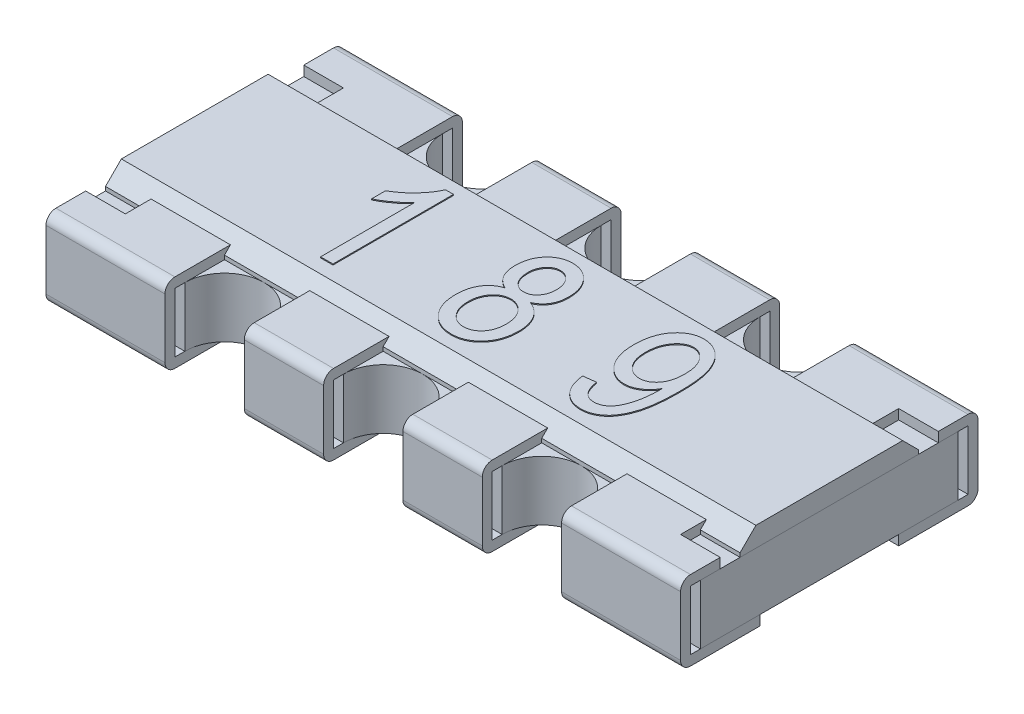
from build123d import *

# Parameters (mm, degrees)
EXTRUDE_THIN1_DEPTH = 1.6
SKETCH6_W           = 0.4
SKETCH6_H           = 0.5
CUT_EXTRUDE3_DEPTH  = 2.811767093
SKETCH7_W           = 0.2
SKETCH7_H           = 1.1
CUT_EXTRUDE4_DEPTH  = 0.1
SKETCH1_W           = 3.2
SKETCH1_H           = 1.3
BOSS_EXTRUDE3_DEPTH = 0.3
SKETCH9_W           = 3.2
SKETCH9_H           = 0.9
BOSS_EXTRUDE4_DEPTH = 0.1
CHAMFER1_START      = -3
CHAMFER1_DEPTH      = 6
CHAMFER1_START_2    = -1
CHAMFER1_2_DEPTH    = 0.4
CHAMFER1_START_3    = -0.2
CHAMFER1_3_DEPTH    = 0.4
CHAMFER1_START_4    = 0.6
CHAMFER1_4_DEPTH    = 0.4
CHAMFER1_5_DEPTH    = 1.6
CHAMFER1_START_5    = 1.4
CHAMFER1_6_DEPTH    = 1.6
SKETCH10_R          = 0.2
CUT_EXTRUDE7_DEPTH  = 5
BOSS_EXTRUDE5_DEPTH = 0.005


with BuildPart() as part:
    # Sketch5 → Extrude-Thin1 (new, symmetric)
    with BuildSketch(Plane(origin=(0, 0, 0), x_dir=(0, 0, -1), z_dir=(1, 0, 0))):
        with BuildLine():
            Line((-0.35, 0), (-0.7, 0))
            ThreePointArc((-0.7, 0), (-0.735355339, 0.014644661), (-0.75, 0.05))
            Line((-0.75, 0.05), (-0.75, 0.35))
            ThreePointArc((-0.75, 0.35), (-0.735355339, 0.385355339), (-0.7, 0.4))
            Line((-0.7, 0.4), (0.7, 0.4))
            ThreePointArc((0.7, 0.4), (0.735355339, 0.385355339), (0.75, 0.35))
            Line((0.75, 0.35), (0.75, 0.05))
            ThreePointArc((0.75, 0.05), (0.735355339, 0.014644661), (0.7, 0))
            Line((0.7, 0), (0.35, 0))
            Line((0.35, 0), (0.35, 0.05))
            Line((0.35, 0.05), (0.7, 0.05))
            Line((0.7, 0.05), (0.7, 0.35))
            Line((0.7, 0.35), (-0.7, 0.35))
            Line((-0.7, 0.35), (-0.7, 0.05))
            Line((-0.7, 0.05), (-0.35, 0.05))
            Line((-0.35, 0.05), (-0.35, 0))
        make_face()
    extrude(amount=EXTRUDE_THIN1_DEPTH, both=True)

    # Sketch6 → Cut-Extrude3 (cut, through all)
    with BuildSketch(Plane(origin=(0, 0.4, 0), x_dir=(1, 0, 0), z_dir=(0, 1, 0))):
        with Locations((-0.8, 0.5)):
            Rectangle(SKETCH6_W, SKETCH6_H)
        with Locations((0, 0.5)):
            Rectangle(SKETCH6_W, SKETCH6_H)
        with Locations((0.8, 0.5)):
            Rectangle(SKETCH6_W, SKETCH6_H)
        with Locations((-0.8, -0.5)):
            Rectangle(SKETCH6_W, SKETCH6_H)
        with Locations((0, -0.5)):
            Rectangle(SKETCH6_W, SKETCH6_H)
        with Locations((0.8, -0.5)):
            Rectangle(SKETCH6_W, SKETCH6_H)
    extrude(amount=-CUT_EXTRUDE3_DEPTH, mode=Mode.SUBTRACT)

    # Sketch7 → Cut-Extrude4 (cut)
    with BuildSketch(Plane(origin=(0, 0.4, 0), x_dir=(1, 0, 0), z_dir=(0, 1, 0))):
        with Locations((-1.5, 0)):
            Rectangle(SKETCH7_W, SKETCH7_H)
        with Locations((1.5, 0)):
            Rectangle(SKETCH7_W, SKETCH7_H)
    extrude(amount=-CUT_EXTRUDE4_DEPTH, mode=Mode.SUBTRACT)

    # Sketch9 → Boss-Extrude4 (add)
    with BuildSketch(Plane(origin=(0, 0.35, 0), x_dir=(1, 0, 0), z_dir=(0, 1, 0))):
        Rectangle(SKETCH9_W, SKETCH9_H)
    extrude(amount=BOSS_EXTRUDE4_DEPTH)

    # Chamfer1: read off the stored shape, not the designer's step
    # Chamfer1 outline → Chamfer1 (cut)
    with BuildSketch(Plane.YZ.offset(CHAMFER1_START)):
        Polygon((0.45, 0.45), (0.4, 0.45), (0.4, 0.42), (0.45, 0.37), align=None)
        Polygon((0.45, -0.45), (0.45, -0.37), (0.4, -0.42), (0.4, -0.45), align=None)
    extrude(amount=CHAMFER1_DEPTH, mode=Mode.SUBTRACT)

    # Chamfer1 2 outline → Chamfer1 2 (cut)
    with BuildSketch(Plane.YZ.offset(CHAMFER1_START_2)):
        Polygon((0.4, 0.42), (0.4, 0.45), (0.37, 0.45), align=None)
        Polygon((0.4, -0.45), (0.4, -0.42), (0.37, -0.45), align=None)
    extrude(amount=CHAMFER1_2_DEPTH, mode=Mode.SUBTRACT)

    # Chamfer1 3 outline → Chamfer1 3 (cut)
    with BuildSketch(Plane.YZ.offset(CHAMFER1_START_3)):
        Polygon((0.4, 0.42), (0.4, 0.45), (0.37, 0.45), align=None)
        Polygon((0.4, -0.45), (0.4, -0.42), (0.37, -0.45), align=None)
    extrude(amount=CHAMFER1_3_DEPTH, mode=Mode.SUBTRACT)

    # Chamfer1 4 outline → Chamfer1 4 (cut)
    with BuildSketch(Plane.YZ.offset(CHAMFER1_START_4)):
        Polygon((0.4, 0.42), (0.4, 0.45), (0.37, 0.45), align=None)
        Polygon((0.4, -0.45), (0.4, -0.42), (0.37, -0.45), align=None)
    extrude(amount=CHAMFER1_4_DEPTH, mode=Mode.SUBTRACT)

    # Chamfer1 5 outline → Chamfer1 5 (cut)
    with BuildSketch(Plane.YZ.offset(CHAMFER1_START)):
        Polygon((0.4, 0.42), (0.4, 0.45), (0.37, 0.45), align=None)
        Polygon((0.4, -0.45), (0.4, -0.42), (0.37, -0.45), align=None)
    extrude(amount=CHAMFER1_5_DEPTH, mode=Mode.SUBTRACT)

    # Chamfer1 6 outline → Chamfer1 6 (cut)
    with BuildSketch(Plane.YZ.offset(CHAMFER1_START_5)):
        Polygon((0.4, 0.42), (0.4, 0.45), (0.37, 0.45), align=None)
        Polygon((0.4, -0.45), (0.4, -0.42), (0.37, -0.45), align=None)
    extrude(amount=CHAMFER1_6_DEPTH, mode=Mode.SUBTRACT)

    # Sketch11 → Boss-Extrude5 (add)
    # profile 1 of 3: a face of its own
    with BuildSketch(Plane(origin=(0, 0.45, 0), x_dir=(1, 0, 0), z_dir=(0, 1, 0))):
        with BuildLine():
            Line((-0.602857143, -0.3), (-0.665194805, -0.3))
            Line((-0.665194805, -0.3), (-0.665194805, 0.175324675))
            add(Edge.make_bspline(
                [(-0.665194805, 0.175324675), (-0.669023189, 0.170917878), (-0.676957509, 0.161784794), (-0.690731083, 0.148796276), (-0.70608021, 0.135402465), (-0.72307373, 0.122405736), (-0.740388775, 0.109956973), (-0.7574906, 0.099008069), (-0.773738236, 0.089481697), (-0.784638106, 0.084303674), (-0.78987013, 0.081818182)],
                knots=[0, 0, 0, 0, 0.892555828, 1.849821039, 2.893015883, 4.008277588, 5.121255548, 6.154629642, 7.114207698, 8, 8, 8, 8], degree=3))
            Line((-0.78987013, 0.081818182), (-0.78987013, 0.151948052))
            add(Edge.make_bspline(
                [(-0.78987013, 0.151948052), (-0.781461846, 0.157008477), (-0.764717276, 0.167085997), (-0.741255942, 0.184543515), (-0.719092323, 0.203386035), (-0.698888884, 0.223810986), (-0.680798923, 0.244866052), (-0.665271894, 0.265879035), (-0.652540714, 0.286626673), (-0.646295662, 0.300898654), (-0.643279221, 0.307792208)],
                knots=[0, 0, 0, 0, 1.082272232, 2.155277244, 3.222407096, 4.289527553, 5.32168536, 6.282742408, 7.170542132, 8, 8, 8, 8], degree=3))
            Line((-0.643279221, 0.307792208), (-0.602857143, 0.307792208))
            Line((-0.602857143, 0.307792208), (-0.602857143, -0.3))
        make_face()
    # profile 2 of 3: a face of its own
    with BuildSketch(Plane(origin=(0, 0.45, 0), x_dir=(1, 0, 0), z_dir=(0, 1, 0))):
        with BuildLine():
            add(Edge.make_bspline(
                [(-0.063952922, 0.029220779), (-0.069688575, 0.032103119), (-0.080878932, 0.037726614), (-0.095794406, 0.048741408), (-0.10851293, 0.061533167), (-0.118989664, 0.076194031), (-0.127095518, 0.092738293), (-0.132731255, 0.111107866), (-0.136395751, 0.131267135), (-0.136716444, 0.145356148), (-0.136883117, 0.152678571)],
                knots=[0, 0, 0, 0, 1.008302473, 1.967215395, 2.901654035, 3.835241807, 4.788827276, 5.786238528, 6.849451133, 8, 8, 8, 8], degree=3))
            add(Edge.make_bspline(
                [(-0.136883117, 0.152678571), (-0.136771499, 0.158284181), (-0.136553302, 0.169242314), (-0.134691032, 0.185291441), (-0.131632439, 0.200505694), (-0.127583097, 0.214996903), (-0.121981094, 0.228544599), (-0.115449116, 0.241469087), (-0.107476728, 0.253482827), (-0.098514623, 0.26469507), (-0.08856843, 0.27474034), (-0.077937656, 0.283570238), (-0.066656484, 0.291090595), (-0.054700741, 0.297153342), (-0.042180382, 0.301952543), (-0.02904559, 0.305410577), (-0.015266907, 0.307315186), (-0.005882071, 0.307631819), (-0.001128247, 0.307792208)],
                knots=[0, 0, 0, 0, 1.165528948, 2.278436123, 3.35437051, 4.390847764, 5.401785756, 6.398351761, 7.397951243, 8.394481506, 9.379254266, 10.332413116, 11.264104055, 12.192693114, 13.114390379, 14.047914605, 15.011184464, 16, 16, 16, 16], degree=3))
            add(Edge.make_bspline(
                [(-0.001128247, 0.307792208), (0.003668022, 0.307645546), (0.013143166, 0.307355811), (0.027020947, 0.30525174), (0.040283534, 0.301830966), (0.052931066, 0.297076614), (0.064943351, 0.290815339), (0.076243059, 0.283106641), (0.086970165, 0.274093232), (0.096981587, 0.263833866), (0.106068365, 0.252446334), (0.113989019, 0.240177379), (0.120917036, 0.22724906), (0.126363099, 0.213375566), (0.130639961, 0.19870367), (0.133637907, 0.183215575), (0.135512931, 0.166969851), (0.135732342, 0.155889953), (0.135844156, 0.150243506)],
                knots=[0, 0, 0, 0, 0.985268531, 1.946421878, 2.87680472, 3.795226773, 4.71648376, 5.65319809, 6.600248485, 7.590936614, 8.593729089, 9.588305238, 10.588007114, 11.602279753, 12.644649782, 13.724021809, 14.840134863, 16, 16, 16, 16], degree=3))
            add(Edge.make_bspline(
                [(0.135844156, 0.150243506), (0.13566623, 0.143205892), (0.135323496, 0.129649528), (0.131788568, 0.110180811), (0.12628551, 0.092331927), (0.118273174, 0.076203524), (0.108031196, 0.061711696), (0.095453277, 0.048998315), (0.080665707, 0.037779681), (0.069430808, 0.032130358), (0.063644481, 0.029220779)],
                knots=[0, 0, 0, 0, 1.126288406, 2.16953834, 3.158564267, 4.109347243, 5.041996175, 5.989081932, 6.964313779, 8, 8, 8, 8], degree=3))
            add(Edge.make_bspline(
                [(0.063644481, 0.029220779), (0.067406002, 0.027699127), (0.074854663, 0.024685914), (0.08540299, 0.019157918), (0.095354188, 0.013100665), (0.104488717, 0.006204903), (0.113079727, -0.001234443), (0.121014328, -0.009395238), (0.128196046, -0.01830272), (0.134636418, -0.027872557), (0.140580111, -0.037964075), (0.145468322, -0.048831691), (0.149814806, -0.060184259), (0.153171151, -0.07218197), (0.155861258, -0.084747042), (0.157764937, -0.097885307), (0.159061053, -0.111621818), (0.159166683, -0.120978993), (0.159220779, -0.125771104)],
                knots=[0, 0, 0, 0, 0.998518868, 1.977292132, 2.928488769, 3.863806314, 4.791620617, 5.724425947, 6.662355446, 7.604692757, 8.562792825, 9.541974082, 10.534927333, 11.553397264, 12.605860047, 13.696849039, 14.820482036, 16, 16, 16, 16], degree=3))
            add(Edge.make_bspline(
                [(0.159220779, -0.125771104), (0.159070241, -0.13230953), (0.158774936, -0.145135727), (0.156760938, -0.163937218), (0.153026375, -0.181790019), (0.148113973, -0.198784915), (0.141597224, -0.214779607), (0.133796313, -0.229930942), (0.124367202, -0.244034464), (0.113679552, -0.257155165), (0.101996355, -0.269006087), (0.089444985, -0.279334214), (0.076261771, -0.288161079), (0.062325399, -0.295434977), (0.047598952, -0.30084361), (0.032299468, -0.304969718), (0.016269356, -0.3072475), (0.005371831, -0.30760893), (-0.000154221, -0.307792208)],
                knots=[0, 0, 0, 0, 1.159749967, 2.275040396, 3.347967098, 4.391166783, 5.408413163, 6.406504519, 7.408740576, 8.411571025, 9.404143995, 10.355316395, 11.289670068, 12.213679047, 13.136228826, 14.066859406, 15.019719104, 16, 16, 16, 16], degree=3))
            add(Edge.make_bspline(
                [(-0.000154221, -0.307792208), (-0.005761662, -0.307610962), (-0.016781062, -0.30725479), (-0.032969765, -0.304964743), (-0.048362884, -0.30087134), (-0.063142938, -0.29539934), (-0.077162937, -0.288204944), (-0.090366817, -0.279289154), (-0.103035924, -0.26905444), (-0.114697959, -0.257138914), (-0.125473004, -0.244064122), (-0.134660571, -0.229726812), (-0.142707592, -0.21454818), (-0.149121783, -0.198282145), (-0.154135899, -0.181039442), (-0.157600506, -0.162772278), (-0.159867184, -0.143563379), (-0.16012726, -0.130404366), (-0.16025974, -0.123701299)],
                knots=[0, 0, 0, 0, 0.984972937, 1.935608695, 2.864070717, 3.777636659, 4.698984135, 5.624239024, 6.571662262, 7.554569506, 8.54763434, 9.542156389, 10.540146702, 11.560717074, 12.60743999, 13.689489912, 14.823049757, 16, 16, 16, 16], degree=3))
            add(Edge.make_bspline(
                [(-0.16025974, -0.123701299), (-0.160200864, -0.118788068), (-0.160085354, -0.109148616), (-0.158845784, -0.094993626), (-0.156779608, -0.081497747), (-0.153990428, -0.068682501), (-0.150471866, -0.056535504), (-0.146079454, -0.045048387), (-0.14085167, -0.034221483), (-0.134840391, -0.024056784), (-0.128190404, -0.014588089), (-0.120867179, -0.005897753), (-0.112890302, 0.001935433), (-0.104332727, 0.009014026), (-0.095180862, 0.015422322), (-0.085309454, 0.020838386), (-0.074886932, 0.02553675), (-0.067628532, 0.027982345), (-0.063952922, 0.029220779)],
                knots=[0, 0, 0, 0, 1.21084686, 2.375606163, 3.49898943, 4.574306622, 5.606312177, 6.613285576, 7.602106595, 8.566331322, 9.521116698, 10.451051306, 11.363604456, 12.273026677, 13.186018397, 14.112988761, 15.044428814, 16, 16, 16, 16], degree=3))
        make_face()
        with BuildLine():
            add(Edge.make_bspline(
                [(-0.074545455, 0.154383117), (-0.074311381, 0.147423054), (-0.073863498, 0.134105502), (-0.069843839, 0.115171062), (-0.06299744, 0.098491557), (-0.053625858, 0.084224964), (-0.042161076, 0.072902561), (-0.029374019, 0.064401779), (-0.015133139, 0.059291962), (-0.00518613, 0.058727237), (-0.000154221, 0.058441558)],
                knots=[0, 0, 0, 0, 1.231806288, 2.356967922, 3.407623546, 4.408504678, 5.359070988, 6.242373184, 7.110866593, 8, 8, 8, 8], degree=3))
            add(Edge.make_bspline(
                [(-0.000154221, 0.058441558), (0.004801204, 0.058720966), (0.01459935, 0.059273427), (0.028534567, 0.064477686), (0.041297596, 0.072616523), (0.052502297, 0.08387803), (0.061879589, 0.097646439), (0.068750654, 0.113578576), (0.072811498, 0.131414359), (0.073269044, 0.143890574), (0.073506494, 0.15036526)],
                knots=[0, 0, 0, 0, 0.904069307, 1.787576968, 2.686104763, 3.657927982, 4.673759711, 5.718490521, 6.815982417, 8, 8, 8, 8], degree=3))
            add(Edge.make_bspline(
                [(0.073506494, 0.15036526), (0.073278276, 0.15704401), (0.072837861, 0.169932669), (0.068654798, 0.188291632), (0.061642837, 0.204758444), (0.0518804, 0.218874195), (0.04050598, 0.23060992), (0.027690852, 0.239137622), (0.013763936, 0.244496169), (0.004031846, 0.245132882), (-0.00088474, 0.245454545)],
                knots=[0, 0, 0, 0, 1.195037322, 2.306184118, 3.351541185, 4.382027117, 5.363972266, 6.261309376, 7.121625266, 8, 8, 8, 8], degree=3))
            add(Edge.make_bspline(
                [(-0.00088474, 0.245454545), (-0.005798161, 0.245172151), (-0.015514491, 0.244613715), (-0.029431034, 0.239422368), (-0.042115054, 0.230974576), (-0.053335121, 0.21955531), (-0.062918822, 0.205890221), (-0.069552538, 0.190100247), (-0.073902782, 0.172797775), (-0.074326347, 0.160661259), (-0.074545455, 0.154383117)],
                knots=[0, 0, 0, 0, 0.904281018, 1.788222997, 2.702503877, 3.698439792, 4.727116192, 5.763971808, 6.843317031, 8, 8, 8, 8], degree=3))
        make_face(mode=Mode.SUBTRACT)
        with BuildLine():
            add(Edge.make_bspline(
                [(-0.097922078, -0.123457792), (-0.097824358, -0.127925779), (-0.097632911, -0.136679169), (-0.096260905, -0.149454476), (-0.094142926, -0.161573595), (-0.090913333, -0.172958389), (-0.086928001, -0.183750888), (-0.081927335, -0.193858606), (-0.076019236, -0.203289725), (-0.069418722, -0.212054066), (-0.061960526, -0.21973158), (-0.054269746, -0.226679087), (-0.046164491, -0.232515815), (-0.037606244, -0.237224414), (-0.02872508, -0.240843324), (-0.019523767, -0.243580262), (-0.009952706, -0.245208113), (-0.003447765, -0.245371713), (-0.000154221, -0.245454545)],
                knots=[0, 0, 0, 0, 1.229957658, 2.409653497, 3.534020377, 4.613053928, 5.663236106, 6.697665706, 7.711552779, 8.723960985, 9.711901018, 10.6537745, 11.574735704, 12.45493582, 13.336836533, 14.210201145, 15.093799183, 16, 16, 16, 16], degree=3))
            add(Edge.make_bspline(
                [(-0.000154221, -0.245454545), (0.003181284, -0.245378126), (0.009729531, -0.245228099), (0.019350691, -0.243525267), (0.028592942, -0.241027843), (0.037440891, -0.237434347), (0.045922656, -0.23291367), (0.053954214, -0.227290004), (0.061568515, -0.220586107), (0.068835194, -0.213039102), (0.075319269, -0.204471378), (0.08131227, -0.195395081), (0.085932966, -0.185386095), (0.09008844, -0.174909583), (0.093004427, -0.163601981), (0.095443676, -0.151675479), (0.096534934, -0.138980834), (0.096765403, -0.130317634), (0.096883117, -0.125892857)],
                knots=[0, 0, 0, 0, 0.929108295, 1.824020855, 2.716353585, 3.594799272, 4.480866403, 5.391315445, 6.321801218, 7.306391719, 8.306918377, 9.31465165, 10.332061206, 11.374528197, 12.453461109, 13.583192095, 14.765602254, 16, 16, 16, 16], degree=3))
            add(Edge.make_bspline(
                [(0.096883117, -0.125892857), (0.096781311, -0.121425637), (0.09658186, -0.112673748), (0.095266348, -0.099880275), (0.092942821, -0.087792082), (0.089764342, -0.076389721), (0.085760109, -0.065602355), (0.080773954, -0.055464878), (0.074778805, -0.046058722), (0.067924586, -0.037447559), (0.060600765, -0.029576799), (0.052784059, -0.02269756), (0.044550279, -0.016951165), (0.03602055, -0.012128111), (0.027074294, -0.008513637), (0.0178392, -0.00575232), (0.00818161, -0.004145612), (0.00159674, -0.003979966), (-0.001737013, -0.003896104)],
                knots=[0, 0, 0, 0, 1.22586307, 2.401631645, 3.524301147, 4.599742544, 5.646428614, 6.677414549, 7.693861764, 8.700930997, 9.693673486, 10.640764112, 11.552218418, 12.444626848, 13.323591672, 14.194048812, 15.08569251, 16, 16, 16, 16], degree=3))
            add(Edge.make_bspline(
                [(-0.001737013, -0.003896104), (-0.005029809, -0.003980971), (-0.011533271, -0.004148589), (-0.021076612, -0.005740561), (-0.030151551, -0.008553012), (-0.039019698, -0.011941926), (-0.047304715, -0.016887556), (-0.055408244, -0.022531114), (-0.062933512, -0.029470495), (-0.070109937, -0.03720879), (-0.076634184, -0.045811713), (-0.082404235, -0.055075423), (-0.087154218, -0.06502045), (-0.091019735, -0.075557157), (-0.094245365, -0.086640062), (-0.096414676, -0.098385108), (-0.09759188, -0.110730641), (-0.097810404, -0.119153437), (-0.097922078, -0.123457792)],
                knots=[0, 0, 0, 0, 0.923472587, 1.823911596, 2.703001348, 3.586871794, 4.479500873, 5.402130619, 6.35347509, 7.344669241, 8.360414412, 9.377945173, 10.401637647, 11.446516964, 12.524200813, 13.636404357, 14.792116778, 16, 16, 16, 16], degree=3))
        make_face(mode=Mode.SUBTRACT)
    # profile 3 of 3: a face of its own
    with BuildSketch(Plane(origin=(0, 0.45, 0), x_dir=(1, 0, 0), z_dir=(0, 1, 0))):
        with BuildLine():
            Line((0.516103896, -0.15974026), (0.578441558, -0.151948052))
            add(Edge.make_bspline(
                [(0.578441558, -0.151948052), (0.579688175, -0.159292248), (0.582046417, -0.173185359), (0.588046979, -0.192324595), (0.59549898, -0.208683329), (0.604815356, -0.222154781), (0.615964009, -0.2326634), (0.628855644, -0.240172778), (0.643447137, -0.244694828), (0.653733526, -0.245195932), (0.659042208, -0.245454545)],
                knots=[0, 0, 0, 0, 1.309725382, 2.477624782, 3.519252249, 4.462492528, 5.34180128, 6.193195808, 7.067530017, 8, 8, 8, 8], degree=3))
            add(Edge.make_bspline(
                [(0.659042208, -0.245454545), (0.663938566, -0.245194884), (0.673646075, -0.244680081), (0.68777681, -0.240594652), (0.701100186, -0.233965977), (0.711610993, -0.2265425), (0.719371905, -0.218967164), (0.725319166, -0.2124195), (0.730741662, -0.204599231), (0.736084759, -0.195929368), (0.741063712, -0.186156746), (0.745963723, -0.175513787), (0.750377536, -0.163742484), (0.756391587, -0.146624748), (0.762598877, -0.123370681), (0.767726451, -0.0935411), (0.770939592, -0.061555374), (0.771337224, -0.039496552), (0.771542208, -0.028125)],
                knots=[0, 0, 0, 0, 0.871681479, 1.728193698, 2.598433288, 3.51585727, 4.0070026, 4.529633168, 5.089671721, 5.700050678, 6.343889226, 7.043128753, 7.787355008, 8.583454758, 10.276770505, 12.068987891, 13.973522342, 16, 16, 16, 16], degree=3))
            Line((0.771542208, -0.028125), (0.771542208, -0.013392857))
            add(Edge.make_bspline(
                [(0.771542208, -0.013392857), (0.768280189, -0.01905054), (0.761841712, -0.030217506), (0.749719329, -0.045116946), (0.73612601, -0.05826527), (0.721122388, -0.06943905), (0.70512898, -0.078221918), (0.688868478, -0.084843685), (0.672294841, -0.088768921), (0.661172208, -0.089330648), (0.655633117, -0.08961039)],
                knots=[0, 0, 0, 0, 1.076943371, 2.125638765, 3.158845653, 4.193572763, 5.204435146, 6.163898621, 7.085618246, 8, 8, 8, 8], degree=3))
            add(Edge.make_bspline(
                [(0.655633117, -0.08961039), (0.650711477, -0.089443452), (0.640969926, -0.089113027), (0.626639565, -0.086567864), (0.612724107, -0.082618672), (0.599484314, -0.076648859), (0.586649326, -0.069316889), (0.574472047, -0.060197956), (0.562711489, -0.049537667), (0.551618088, -0.037312428), (0.541331798, -0.02370103), (0.532475529, -0.008695569), (0.525006389, 0.007511748), (0.518967357, 0.024905211), (0.51404559, 0.043445283), (0.510683978, 0.063248995), (0.508769278, 0.084255769), (0.508466876, 0.098656736), (0.508311688, 0.106047078)],
                knots=[0, 0, 0, 0, 0.86465958, 1.711446896, 2.551263658, 3.400931007, 4.257488752, 5.144979063, 6.069240711, 7.043889745, 8.042652401, 9.063041585, 10.100422143, 11.174417838, 12.295707709, 13.468554313, 14.700903177, 16, 16, 16, 16], degree=3))
            add(Edge.make_bspline(
                [(0.508311688, 0.106047078), (0.508452646, 0.113641802), (0.508728319, 0.128494889), (0.510852788, 0.150130282), (0.514104095, 0.170576262), (0.519257826, 0.189648393), (0.525312493, 0.207623662), (0.53308388, 0.224258969), (0.542080153, 0.239739205), (0.552561975, 0.253769133), (0.563935948, 0.266411232), (0.576074658, 0.277428982), (0.588710719, 0.286928451), (0.602144918, 0.294475859), (0.616052184, 0.300581775), (0.630661271, 0.304616886), (0.645791311, 0.307342011), (0.656107738, 0.307640415), (0.661355519, 0.307792208)],
                knots=[0, 0, 0, 0, 1.28857615, 2.520082744, 3.686305779, 4.797202427, 5.868826455, 6.901108228, 7.907493629, 8.90202596, 9.867517396, 10.788992686, 11.680218227, 12.543873392, 13.398473814, 14.25085117, 15.110239307, 16, 16, 16, 16], degree=3))
            add(Edge.make_bspline(
                [(0.661355519, 0.307792208), (0.665094481, 0.307701294), (0.67256026, 0.307519761), (0.683628191, 0.305971259), (0.694517502, 0.303699247), (0.705212315, 0.300391382), (0.715639311, 0.295968726), (0.725908179, 0.290678133), (0.736091826, 0.284630521), (0.745872484, 0.277403519), (0.755425781, 0.269388331), (0.764417961, 0.260375097), (0.772810936, 0.250430754), (0.780822949, 0.239752887), (0.787896355, 0.227921349), (0.794815144, 0.215412761), (0.800956783, 0.201871166), (0.806629922, 0.18738291), (0.811658792, 0.171613522), (0.816021369, 0.154336731), (0.819596022, 0.135418113), (0.822676682, 0.114914821), (0.824895424, 0.092765342), (0.826632766, 0.068976497), (0.827560051, 0.043554427), (0.827713298, 0.026055845), (0.827792208, 0.017045455)],
                knots=[0, 0, 0, 0, 0.71982096, 1.437303798, 2.148671553, 2.860726122, 3.5894893, 4.327127712, 5.084546776, 5.867862187, 6.666549548, 7.484587174, 8.316328227, 9.17150421, 10.052303838, 10.968733071, 11.923593905, 12.913579202, 13.964198915, 15.109293659, 16.343376022, 17.671051532, 19.10143247, 20.629623286, 22.264521701, 24, 24, 24, 24], degree=3))
            add(Edge.make_bspline(
                [(0.827792208, 0.017045455), (0.827725829, 0.00697955), (0.827597044, -0.012549795), (0.826497371, -0.04101268), (0.824657974, -0.067723513), (0.822319352, -0.092756862), (0.819049487, -0.115994047), (0.814980334, -0.137504845), (0.810509247, -0.157356885), (0.80495726, -0.175495578), (0.798764089, -0.192127163), (0.792415006, -0.207652074), (0.785321624, -0.22196579), (0.777657121, -0.235066392), (0.769615534, -0.247134703), (0.76098471, -0.257973109), (0.751803849, -0.267652611), (0.742177959, -0.276195143), (0.732129577, -0.283644924), (0.721816021, -0.290140142), (0.711119794, -0.295455844), (0.7002816, -0.300092681), (0.68897843, -0.303417151), (0.677446573, -0.306045118), (0.665573336, -0.307505993), (0.6575848, -0.30769637), (0.653563312, -0.307792208)],
                knots=[0, 0, 0, 0, 1.764807986, 3.42398863, 4.99306403, 6.458696006, 7.831295522, 9.105472131, 10.296422921, 11.39714146, 12.428197542, 13.407419317, 14.336630445, 15.226313195, 16.067043525, 16.877164758, 17.652279824, 18.403342349, 19.130566392, 19.843339087, 20.537068434, 21.222906937, 21.90719335, 22.599498013, 23.294976811, 24, 24, 24, 24], degree=3))
            add(Edge.make_bspline(
                [(0.653563312, -0.307792208), (0.649010566, -0.307684191), (0.64007016, -0.307472073), (0.626959848, -0.305532694), (0.614407327, -0.302709823), (0.60246199, -0.298491494), (0.591080661, -0.293105501), (0.580257393, -0.286548724), (0.570052792, -0.278756687), (0.560411462, -0.269885379), (0.551569633, -0.259796793), (0.543589842, -0.24863791), (0.536632422, -0.23638998), (0.530713673, -0.22305995), (0.525591213, -0.208734851), (0.521289528, -0.193376687), (0.518191114, -0.176904626), (0.516810702, -0.16555272), (0.516103896, -0.15974026)],
                knots=[0, 0, 0, 0, 0.974221956, 1.913117753, 2.832138983, 3.725325793, 4.619357623, 5.523969086, 6.429456606, 7.364160882, 8.324683532, 9.296460859, 10.296689072, 11.335178463, 12.415402788, 13.551768977, 14.746444432, 16, 16, 16, 16], degree=3))
        make_face()
        with BuildLine():
            add(Edge.make_bspline(
                [(0.765454545, 0.10762987), (0.765356254, 0.112827727), (0.765163943, 0.122997461), (0.763808763, 0.137800412), (0.761662709, 0.151813135), (0.758497252, 0.164916654), (0.754509618, 0.177210893), (0.749480778, 0.188562444), (0.743638602, 0.199097464), (0.736942409, 0.208687889), (0.729697732, 0.217257659), (0.722107946, 0.224800583), (0.714180404, 0.231089969), (0.706111784, 0.236471999), (0.697660119, 0.240506206), (0.688892454, 0.243322675), (0.679890784, 0.245074477), (0.673781963, 0.245327938), (0.670730519, 0.245454545)],
                knots=[0, 0, 0, 0, 1.345999961, 2.633481834, 3.846522151, 5.014086171, 6.12088659, 7.189137531, 8.224301127, 9.236041944, 10.213065705, 11.127237019, 12.002136993, 12.83006775, 13.63396595, 14.418389675, 15.209963153, 16, 16, 16, 16], degree=3))
            add(Edge.make_bspline(
                [(0.670730519, 0.245454545), (0.667515624, 0.245338642), (0.661114694, 0.245107875), (0.651696697, 0.243214994), (0.642515288, 0.240137092), (0.633690656, 0.235703399), (0.625020289, 0.230182227), (0.616806749, 0.2232723), (0.608672891, 0.215315058), (0.600995997, 0.206122765), (0.593835242, 0.195985485), (0.587548744, 0.18491466), (0.582354866, 0.172977482), (0.578137172, 0.160244833), (0.574613949, 0.146767171), (0.57245784, 0.132399054), (0.570895032, 0.11724202), (0.570732617, 0.106863197), (0.570649351, 0.101542208)],
                knots=[0, 0, 0, 0, 0.795597862, 1.584053309, 2.369106213, 3.187177883, 4.023566861, 4.908945974, 5.83998388, 6.838605549, 7.870313796, 8.9100199, 9.985637853, 11.088521482, 12.229358934, 13.430623134, 14.682738284, 16, 16, 16, 16], degree=3))
            add(Edge.make_bspline(
                [(0.570649351, 0.101542208), (0.570751207, 0.096750639), (0.57095015, 0.087391882), (0.572253618, 0.073746339), (0.574614057, 0.060857002), (0.577728231, 0.048709008), (0.5817488, 0.037275803), (0.586752439, 0.026618978), (0.592758462, 0.016739144), (0.599520945, 0.007637885), (0.60698206, -0.000472118), (0.614712998, -0.007771112), (0.623050413, -0.013709069), (0.631661626, -0.018627403), (0.640553247, -0.022627945), (0.649923243, -0.025216697), (0.659577566, -0.027072296), (0.666175889, -0.027205407), (0.669512987, -0.027272727)],
                knots=[0, 0, 0, 0, 1.270391188, 2.481292313, 3.629423926, 4.741182195, 5.802977916, 6.837826839, 7.856438293, 8.863562247, 9.838501743, 10.775102984, 11.676942478, 12.544429056, 13.402050266, 14.253371081, 15.116643449, 16, 16, 16, 16], degree=3))
            add(Edge.make_bspline(
                [(0.669512987, -0.027272727), (0.672804702, -0.027134308), (0.679303834, -0.026861014), (0.688870192, -0.025336391), (0.697959502, -0.02238777), (0.706797253, -0.018713118), (0.715118357, -0.013598119), (0.723027753, -0.00746771), (0.7306794, -0.000353673), (0.73777324, 0.007919736), (0.744426258, 0.017115586), (0.749935854, 0.027469035), (0.754884393, 0.038530998), (0.758744669, 0.05058974), (0.761771753, 0.063538297), (0.763966638, 0.077411573), (0.765127971, 0.092228592), (0.765343493, 0.102392641), (0.765454545, 0.10762987)],
                knots=[0, 0, 0, 0, 0.854962158, 1.688029758, 2.504410095, 3.330252108, 4.166776435, 5.030713634, 5.925137581, 6.873583428, 7.855774289, 8.86472059, 9.911937097, 10.998017063, 12.145369077, 13.361241875, 14.64032716, 16, 16, 16, 16], degree=3))
        make_face(mode=Mode.SUBTRACT)
    extrude(amount=BOSS_EXTRUDE5_DEPTH)


with BuildPart() as body_2:
    # Sketch1 → Boss-Extrude3 (new body)
    with BuildSketch(Plane(origin=(0, 0.05, 0), x_dir=(1, 0, 0), z_dir=(0, 1, 0))):
        Rectangle(SKETCH1_W, SKETCH1_H)
    extrude(amount=BOSS_EXTRUDE3_DEPTH)

    # Sketch10 → Cut-Extrude7 (cut)
    with BuildSketch(Plane(origin=(0, 0.05, 0), x_dir=(1, 0, 0), z_dir=(0, 1, 0))):
        with Locations((-0.8, 0.65)):
            Circle(SKETCH10_R)
        with Locations((0, 0.65)):
            Circle(SKETCH10_R)
        with Locations((0.8, 0.65)):
            Circle(SKETCH10_R)
        with Locations((0.8, -0.65)):
            Circle(SKETCH10_R)
        with Locations((0, -0.65)):
            Circle(SKETCH10_R)
        with Locations((-0.8, -0.65)):
            Circle(SKETCH10_R)
    extrude(amount=CUT_EXTRUDE7_DEPTH, mode=Mode.SUBTRACT)


solid = Compound([part.part, body_2.part])
